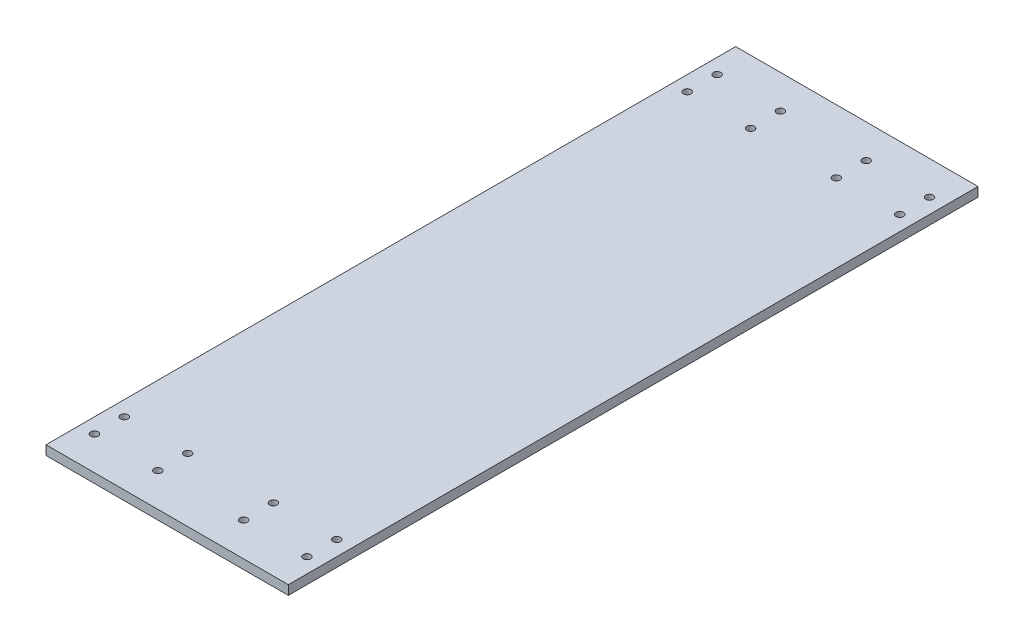
from build123d import *

# Parameters (mm, degrees)
SKETCH2_W                                  = 130
SKETCH2_H                                  = 370
BOSS_EXTRUDE1_DEPTH                        = 5
SKETCH3_R                                  = 2
CUT_EXTRUDE1_DEPTH                         = 10
MIRROR1_AT_THE_SECOND_PLANE_COPY_1_SKETC_R = 2
MIRROR1_AT_THE_SECOND_PLANE_COPY_1_DEPTH   = 10


with BuildPart() as part:
    # Sketch2 → Boss-Extrude1 (new body)
    with BuildSketch(Plane(origin=(0, 0, 0), x_dir=(1, 0, 0), z_dir=(0, 1, 0))):
        Rectangle(SKETCH2_W, SKETCH2_H)
    extrude(amount=BOSS_EXTRUDE1_DEPTH)

    # Sketch3 → Cut-Extrude1 (cut)
    with BuildSketch(Plane(origin=(0, 5, 0), x_dir=(1, 0, 0), z_dir=(0, 1, 0))):
        with Locations((-57, 167)):
            Circle(SKETCH3_R)
        with Locations((-57, 151)):
            Circle(SKETCH3_R)
        with Locations((-23, 167)):
            Circle(SKETCH3_R)
        with Locations((-23, 151)):
            Circle(SKETCH3_R)
    cut_extrude1 = extrude(amount=-CUT_EXTRUDE1_DEPTH, mode=Mode.SUBTRACT)

    # Mirror1: Cut-Extrude1 across plane
    add(cut_extrude1.mirror(Plane.XY), mode=Mode.SUBTRACT)

    # Mirror1 at the second plane: Cut-Extrude1 across plane
    add(cut_extrude1.mirror(Plane(origin=(0, 0, 0), x_dir=(0, 0, 1), z_dir=(1, 0, 0))), mode=Mode.SUBTRACT)

    # Mirror1 at the second plane copy 1 sketc → Mirror1 at the second plane copy 1 (cut)
    with BuildSketch(Plane(origin=(0, 5, 0), x_dir=(-1, 0, 0), z_dir=(0, 1, 0))):
        with Locations((-57, 167)):
            Circle(MIRROR1_AT_THE_SECOND_PLANE_COPY_1_SKETC_R)
        with Locations((-57, 151)):
            Circle(MIRROR1_AT_THE_SECOND_PLANE_COPY_1_SKETC_R)
        with Locations((-23, 167)):
            Circle(MIRROR1_AT_THE_SECOND_PLANE_COPY_1_SKETC_R)
        with Locations((-23, 151)):
            Circle(MIRROR1_AT_THE_SECOND_PLANE_COPY_1_SKETC_R)
    extrude(amount=-MIRROR1_AT_THE_SECOND_PLANE_COPY_1_DEPTH, mode=Mode.SUBTRACT)


solid = part.part
